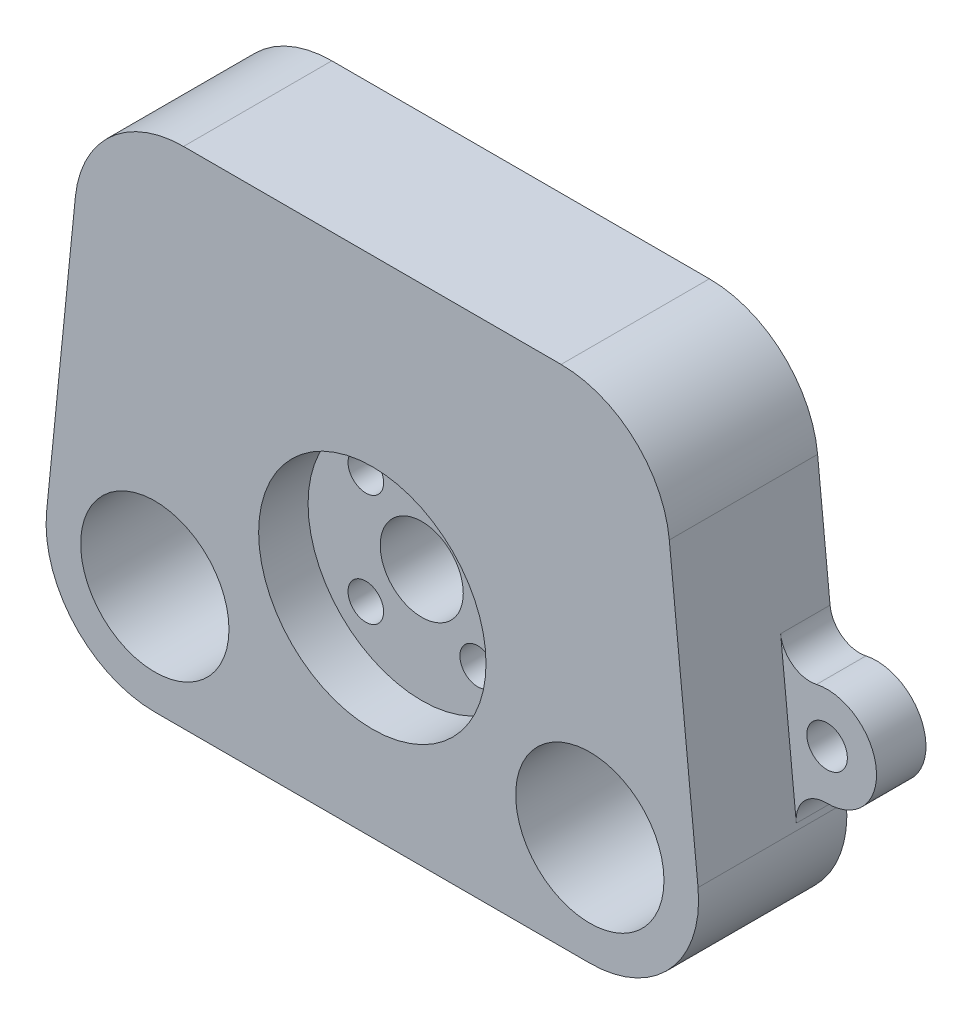
from build123d import *

# Parameters (mm, degrees)
CROQUIS2_R                                           = 7.5
CROQUIS2_R_2                                         = 4.2
SALIENTE_EXTRUIR1_DEPTH                              = 15
REDONDEO2_R                                          = 11
CROQUIS4_R                                           = 11.5
CORTAR_EXTRUIR1_DEPTH                                = 5
REFRENTADO_PARA_TORNILLO_CON_CABEZA_HUEC_D           = 3.6
REFRENTADO_PARA_TORNILLO_CON_CABEZA_HUEC_CBORE_D     = 6.5
REFRENTADO_PARA_TORNILLO_CON_CABEZA_HUEC_CBORE_DEPTH = 4.4
MATRIZC1_COUNT                                       = 4
CROQUIS18_R                                          = 5
CROQUIS18_R_2                                        = 2.05
SALIENTE_EXTRUIR2_DEPTH                              = 5
REDONDEO3_R                                          = 3


with BuildPart() as part:
    # Croquis2 → Saliente-Extruir1 (new body)
    with BuildSketch(Plane.XY):
        Polygon((-34.156880773, -21), (34.156880773, -21), (29.048373678, 30), (-29.048373678, 30), align=None)
        with Locations((22, -10)):
            Circle(CROQUIS2_R, mode=Mode.SUBTRACT)
        with Locations((-22, -10)):
            Circle(CROQUIS2_R, mode=Mode.SUBTRACT)
        Circle(CROQUIS2_R_2, mode=Mode.SUBTRACT)
    extrude(amount=SALIENTE_EXTRUIR1_DEPTH)

    # Redondeo2
    redondeo2_edges = [part.edges().sort_by_distance(p)[0] for p in [
        (34.156880773, -21, 7.5),
        (-34.156880773, -21, 7.5),
        (29.048373678, 30, 7.5),
        (-29.048373678, 30, 7.5),
    ]]
    fillet(redondeo2_edges, radius=REDONDEO2_R)

    # Croquis4 → Cortar-Extruir1 (cut)
    with BuildSketch(Plane.XY.offset(15)):
        Circle(CROQUIS4_R)
    extrude(amount=-CORTAR_EXTRUIR1_DEPTH, mode=Mode.SUBTRACT)

    # Refrentado para tornillo con cabeza hueca de M31 (through all)
    with Locations(Plane(origin=(0, 0, 0), x_dir=(-1, 0, 0), z_dir=(0, 0, -1))):
        with Locations((-5.656854249, 5.656854249)):
            refrentado_para_tornillo_con_cabeza_huec = CounterBoreHole(REFRENTADO_PARA_TORNILLO_CON_CABEZA_HUEC_D / 2, REFRENTADO_PARA_TORNILLO_CON_CABEZA_HUEC_CBORE_D / 2, REFRENTADO_PARA_TORNILLO_CON_CABEZA_HUEC_CBORE_DEPTH)

    # MatrizC1: Refrentado para tornillo con cabeza hueca de M31 ×4 about axis
    matrizc1_axis = Axis((0, 0, 15), (0, 0, -1))
    for i in range(1, MATRIZC1_COUNT):
        add(refrentado_para_tornillo_con_cabeza_huec.rotate(matrizc1_axis, i * 360 / MATRIZC1_COUNT), mode=Mode.SUBTRACT)

    # Croquis18 → Saliente-Extruir2 (add)
    with BuildSketch(Plane.XY):
        with Locations((36, 0)):
            Circle(CROQUIS18_R)
        with Locations((36, 0)):
            Circle(CROQUIS18_R_2, mode=Mode.SUBTRACT)
    extrude(amount=SALIENTE_EXTRUIR2_DEPTH)

    # Redondeo3
    redondeo3_edges = [part.edges().sort_by_distance(p)[0] for p in [
        (32.401053085, -3.470962561, 2.5),
        (31.784111899, 2.6881755, 2.5),
    ]]
    fillet(redondeo3_edges, radius=REDONDEO3_R)


solid = part.part
